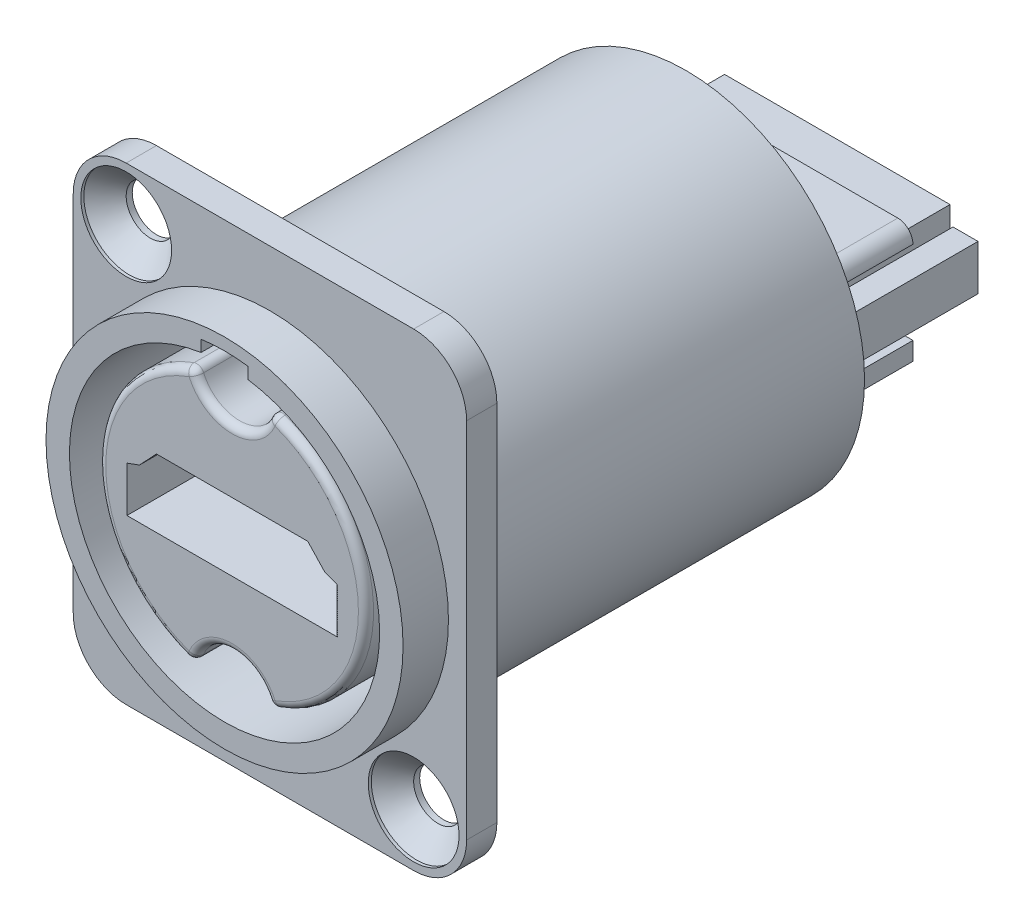
from build123d import *

# Parameters (mm, degrees)
ESQUISSE1_W                                 = 11.8
ESQUISSE1_H                                 = 25.5
ESQUISSE2_W                                 = 24.8
ESQUISSE2_H                                 = 27.3
BOSS_EXTRU_1_DEPTH                          = 2
ESQUISSE3_W                                 = 2
ESQUISSE3_H                                 = 27.3
BOSS_EXTRU_2_DEPTH                          = 1.2
BOSS_EXTRU_3_DEPTH                          = 10
ESQUISSE5_W                                 = 10
ESQUISSE5_H                                 = 1.115484429
ENL_V_MAT_EXTRU_1_DEPTH                     = 3.6
ESQUISSE6_W                                 = 10
ESQUISSE6_H                                 = 1.384515571
ENL_V_MAT_EXTRU_2_DEPTH                     = 1.65
ESQUISSE7_W                                 = 10
ESQUISSE7_H                                 = 1.384515571
ENL_V_MAT_EXTRU_3_DEPTH                     = 1.65
BOSS_EXTRU_4_DEPTH                          = 0.2
BOSS_EXTRU_5_DEPTH                          = 0.2
ESQUISSE10_W                                = 26
ESQUISSE10_H                                = 2
BOSS_EXTRU_6_DEPTH                          = 3.7
BOSS_EXTRU_7_START                          = 3
ESQUISSE11_R                                = 11.8
BOSS_EXTRU_7_DEPTH                          = 3
ENL_V_MAT_EXTRU_4_DEPTH                     = 14
BOSS_EXTRU_8_DEPTH                          = 13.5
ENL_V_MAT_EXTRU_5_DEPTH                     = 11
ESQUISSE15_W                                = 11
ESQUISSE15_H                                = 1
BOSS_EXTRU_9_DEPTH                          = 6.6
ENL_V_MAT_EXTRU_6_DEPTH                     = 12
ESQUISSE17_W                                = 11
ESQUISSE17_H                                = 1
BOSS_EXTRU_10_DEPTH                         = 9.6
D_POUILLE1_ANGLE                            = 20.013261752
D_POUILLE2_ANGLE                            = 20.013261752
D_POUILLE3_ANGLE                            = 20.013261752
D_POUILLE4_ANGLE                            = 20.013261752
D_POUILLE5_ANGLE                            = 43.186676481
D_POUILLE6_ANGLE                            = 43.186676481
D_POUILLE7_ANGLE                            = 43.186676481
FRAISAGE_POUR_VIS_T_TE_FRAIS_E_M31_AT_COUNT = 2
FRAISAGE_POUR_VIS_T_TE_FRAIS_E_M31_AT_PITCH = 30.61045573
NERVURE1_START                              = -8.5
NERVURE1_OUTLINE_W                          = 1
NERVURE1_OUTLINE_H                          = 6.5
NERVURE1_DEPTH                              = 17
NERVURE2_START                              = -8.5
NERVURE2_OUTLINE_W                          = 1.2
NERVURE2_OUTLINE_H                          = 6.5
NERVURE2_DEPTH                              = 17
CHANFREIN1_SIZE                             = 0.027978428
CHANFREIN1_SIZE2                            = 0.021236921
CHANFREIN2_SIZE                             = 0.027978428
CHANFREIN2_SIZE2                            = 0.021236921
CONG_1_R                                    = 0.5
CONG_2_R                                    = 1
CONG_3_R                                    = 3.5


# Read off the part's stored shape, not the designer's step: Nervure1, Nervure2
with BuildPart() as part:
    # Esquisse1 → Révolution1 (revolve)
    with BuildSketch(Plane.XZ, mode=Mode.PRIVATE) as r_volution1_sk:
        with Locations((5.9, -12.75)):
            Rectangle(ESQUISSE1_W, ESQUISSE1_H)
    revolve(r_volution1_sk.sketch.rotate(Axis((0, 0, 0), (0, 0, -1)), 180), axis=Axis((0, 0, 0), (0, 0, -1)))

    # Esquisse2 → Boss.-Extru.1 (add)
    with BuildSketch(Plane(origin=(0, 0, 0), x_dir=(-1, 0, 0), z_dir=(0, 0, -1))):
        with Locations((0.6, -1.85)):
            Rectangle(ESQUISSE2_W, ESQUISSE2_H)
    extrude(amount=-BOSS_EXTRU_1_DEPTH)

    # Esquisse3 → Boss.-Extru.2 (add)
    with BuildSketch(Plane(origin=(11.8, 0, 0), x_dir=(0, 0, -1), z_dir=(1, 0, 0))):
        with Locations((-1, -1.85)):
            Rectangle(ESQUISSE3_W, ESQUISSE3_H)
    extrude(amount=BOSS_EXTRU_2_DEPTH)

    # Esquisse4 → Boss.-Extru.3 (add)
    with BuildSketch(Plane(origin=(0, 0, -25.5), x_dir=(-1, 0, 0), z_dir=(0, 0, -1))):
        Polygon((-9.1, 2.85), (9.1, 2.85), (9.1, -2.65), (-5.5, -2.65), (-5.5, -1.534515571), (-9.1, -1.534515571), align=None)
    extrude(amount=BOSS_EXTRU_3_DEPTH)

    # Esquisse5 → Enlèv. mat.-Extru.1 (cut)
    with BuildSketch(Plane.ZY.offset(9.1)):
        with Locations((-30.5, -2.092257786)):
            Rectangle(ESQUISSE5_W, ESQUISSE5_H)
    extrude(amount=-ENL_V_MAT_EXTRU_1_DEPTH, mode=Mode.SUBTRACT)

    # Esquisse6 → Enlèv. mat.-Extru.2 (cut)
    with BuildSketch(Plane(origin=(9.1, 0, 0), x_dir=(0, 0, -1), z_dir=(1, 0, 0))):
        with Locations((30.5, 2.157742215)):
            Rectangle(ESQUISSE6_W, ESQUISSE6_H)
    extrude(amount=-ENL_V_MAT_EXTRU_2_DEPTH, mode=Mode.SUBTRACT)

    # Esquisse7 → Enlèv. mat.-Extru.3 (cut)
    with BuildSketch(Plane.ZY.offset(9.1)):
        with Locations((-30.5, 2.157742215)):
            Rectangle(ESQUISSE7_W, ESQUISSE7_H)
    extrude(amount=-ENL_V_MAT_EXTRU_3_DEPTH, mode=Mode.SUBTRACT)

    # Esquisse8 → Boss.-Extru.4 (add)
    with BuildSketch(Plane(origin=(0, 0, -35.5), x_dir=(-1, 0, 0), z_dir=(0, 0, -1))):
        Polygon((-6.575, -1.534515571), (-9.1, -1.534515571), (-9.1, 1.465484429), (-7.45, 1.465484429), (-7.45, -1.215812238), align=None)
    extrude(amount=BOSS_EXTRU_4_DEPTH)

    # Esquisse9 → Boss.-Extru.5 (add)
    with BuildSketch(Plane(origin=(0, 0, -35.5), x_dir=(-1, 0, 0), z_dir=(0, 0, -1))):
        Polygon((6.575, -1.534515571), (7.45, -1.215812238), (7.45, 1.465484429), (9.1, 1.465484429), (9.1, -1.534515571), align=None)
    extrude(amount=BOSS_EXTRU_5_DEPTH)

    # Esquisse10 → Boss.-Extru.6 (add)
    with BuildSketch(Plane(origin=(0, 11.8, 0), x_dir=(-1, 0, 0), z_dir=(0, 1, 0))):
        with Locations((0, 1)):
            Rectangle(ESQUISSE10_W, ESQUISSE10_H)
    extrude(amount=BOSS_EXTRU_6_DEPTH)

    # Esquisse11 → Boss.-Extru.7 (add)
    with BuildSketch(Plane.XY.offset(2).offset(BOSS_EXTRU_7_START)):
        with Locations(Location((0, 0, 0), (0, 0, 180))):
            Circle(ESQUISSE11_R)
    extrude(amount=-BOSS_EXTRU_7_DEPTH)

    # Esquisse12 → Enlèv. mat.-Extru.4 (cut)
    with BuildSketch(Plane.XY.offset(5)):
        with BuildLine():
            Line((1.55, 10.132127121), (1.55, 10.890247931))
            ThreePointArc((1.55, 10.890247931), (0, 11), (-1.55, 10.890247931))
            Line((-1.55, 10.890247931), (-1.55, 10.132127121))
            ThreePointArc((-1.55, 10.132127121), (0, -10.25), (1.55, 10.132127121))
        make_face()
    extrude(amount=-ENL_V_MAT_EXTRU_4_DEPTH, mode=Mode.SUBTRACT)

    # Esquisse13 → Boss.-Extru.8 (add)
    with BuildSketch(Plane.XY.offset(-9)):
        with BuildLine():
            ThreePointArc((2.525486644, -8.482005495), (0, -6.5), (-2.525486644, -8.482005495))
            ThreePointArc((-2.525486644, -8.482005495), (-8.85, 0), (-2.525486644, 8.482005495))
            ThreePointArc((-2.525486644, 8.482005495), (0, 6.5), (2.525486644, 8.482005495))
            ThreePointArc((2.525486644, 8.482005495), (8.85, 0), (2.525486644, -8.482005495))
        make_face()
    extrude(amount=BOSS_EXTRU_8_DEPTH)

    # Esquisse14 → Enlèv. mat.-Extru.5 (cut)
    with BuildSketch(Plane.XY.offset(4.5)):
        Polygon((5, 0.85), (5, 2.35), (-5, 2.35), (-5, 0.85), (-6.95, 0.85), (-6.95, -2.15), (6.95, -2.15), (6.95, 0.85), align=None)
    extrude(amount=-ENL_V_MAT_EXTRU_5_DEPTH, mode=Mode.SUBTRACT)

    # Esquisse15 → Boss.-Extru.9 (add)
    with BuildSketch(Plane.XY.offset(-6.5)):
        with Locations((0, 0.05)):
            Rectangle(ESQUISSE15_W, ESQUISSE15_H)
    extrude(amount=BOSS_EXTRU_9_DEPTH)

    # Esquisse16 → Enlèv. mat.-Extru.6 (cut)
    with BuildSketch(Plane(origin=(0, 0, -35.5), x_dir=(-1, 0, 0), z_dir=(0, 0, -1))):
        Polygon((5.283561654, -2.15), (5.283561654, -0.865794698), (6.95, -0.865794698), (6.95, 2.35), (-6.95, 2.35), (-6.95, -0.865794698), (-5.283561654, -0.865794698), (-5.283561654, -2.15), align=None)
    extrude(amount=-ENL_V_MAT_EXTRU_6_DEPTH, mode=Mode.SUBTRACT)

    # Esquisse17 → Boss.-Extru.10 (add)
    with BuildSketch(Plane(origin=(0, 0, -23.5), x_dir=(-1, 0, 0), z_dir=(0, 0, -1))):
        with Locations((0, -0.15)):
            Rectangle(ESQUISSE17_W, ESQUISSE17_H)
    extrude(amount=BOSS_EXTRU_10_DEPTH)

    # Dépouille1
    d_pouille1_faces = [part.faces().sort_by_distance(p)[0] for p in [
        (-6.116780827, -0.865794698, -29.5),
    ]]
    draft(d_pouille1_faces, Plane(origin=(-6.95, -0.865794698, -23.5), x_dir=(0, 1, 0), z_dir=(1, 0, 0)), D_POUILLE1_ANGLE)

    # Dépouille2
    d_pouille2_faces = [part.faces().sort_by_distance(p)[0] for p in [
        (6.116780827, -0.865794698, -29.5),
    ]]
    draft(d_pouille2_faces, Plane(origin=(6.95, 2.35, -23.5), x_dir=(0, -1, 0), z_dir=(-1, 0, 0)), D_POUILLE2_ANGLE)

    # Dépouille3
    d_pouille3_faces = [part.faces().sort_by_distance(p)[0] for p in [
        (-5.975, 0.85, -1),
    ]]
    draft(d_pouille3_faces, Plane(origin=(-6.95, 0.85, -6.5), x_dir=(0, 1, 0), z_dir=(1, 0, 0)), D_POUILLE3_ANGLE)

    # Dépouille4
    d_pouille4_faces = [part.faces().sort_by_distance(p)[0] for p in [
        (5.975, 0.85, -1),
    ]]
    draft(d_pouille4_faces, Plane(origin=(6.95, -2.15, -6.5), x_dir=(0, 0, -1), z_dir=(-1, 0, 0)), D_POUILLE4_ANGLE)

    # Dépouille5
    d_pouille5_faces = [part.faces().sort_by_distance(p)[0] for p in [
        (5.5, -2.092257785, -30.5),
        (-5.5, -2.092257785, -30.5),
    ]]
    draft(d_pouille5_faces, Plane(origin=(-9.1, -2.65, -35.5), x_dir=(-1, 0, 0), z_dir=(0, -1, 0)), D_POUILLE5_ANGLE)

    # Dépouille6
    d_pouille6_faces = [part.faces().sort_by_distance(p)[0] for p in [
        (-5.283561654, -1.811382752, -29.5),
        (5.283561654, -1.811382752, -29.5),
    ]]
    draft(d_pouille6_faces, Plane(origin=(5.283561654, -2.15, -23.5), x_dir=(1, 0, 0), z_dir=(0, 1, 0)), D_POUILLE6_ANGLE)

    # Dépouille7
    d_pouille7_faces = [part.faces().sort_by_distance(p)[0] for p in [
        (-5, 1.955126571, -1),
        (5, 1.955126571, -1),
    ]]
    draft(d_pouille7_faces, Plane(origin=(5, 2.35, -6.5), x_dir=(-1, 0, 0), z_dir=(0, -1, 0)), D_POUILLE7_ANGLE)

    # Esquisse18 → Fraisage pour vis à tête fraisée M31 (revolve, cut)
    with BuildSketch(Plane(origin=(-9.5, 12, 2), x_dir=(0, -1, 0), z_dir=(1, 0, 0))):
        Polygon((0, 0), (0, 37.700025), (1.6, 37.700025), (1.6, 1.599995685), (3, 0.19999191), (3, 0), align=None)
    fraisage_pour_vis_t_te_frais_e_m31 = revolve(axis=Axis((-9.5, 12, 8.35), (0, 0, -1)), mode=Mode.SUBTRACT)

    # Fraisage pour vis à tête fraisée M31 at: Fraisage pour vis à tête fraisée M31 ×2
    with Locations(*[Vector(0.6207029443655612, -0.7840458244617614, 0) * (i * FRAISAGE_POUR_VIS_T_TE_FRAIS_E_M31_AT_PITCH) for i in range(1, FRAISAGE_POUR_VIS_T_TE_FRAIS_E_M31_AT_COUNT)]):
        add(fraisage_pour_vis_t_te_frais_e_m31, mode=Mode.SUBTRACT)

    # Nervure1 outline → Nervure1 (add)
    with BuildSketch(Plane(origin=(0, 0, 0), x_dir=(0, -1, 0), z_dir=(-1, 0, 0)).offset(NERVURE1_START)):
        with Locations((-3.35, -28.75)):
            Rectangle(NERVURE1_OUTLINE_W, NERVURE1_OUTLINE_H)
    extrude(amount=NERVURE1_DEPTH)

    # Nervure2 outline → Nervure2 (add)
    with BuildSketch(Plane(origin=(0, 0, 0), x_dir=(0, -1, 0), z_dir=(-1, 0, 0)).offset(NERVURE2_START)):
        with Locations((3.25, -28.75)):
            Rectangle(NERVURE2_OUTLINE_W, NERVURE2_OUTLINE_H)
    extrude(amount=NERVURE2_DEPTH)

    # Chanfrein1
    chanfrein1_edges = [part.edges().sort_by_distance(p)[0] for p in [
        (6.547021572, -1.534515571, -30.5),
    ]]
    chanfrein1_side = [part.faces().sort_by_distance(p)[0] for p in [
        (7.823782137, -1.534515571, -30.598925344),
    ]]
    chamfer(chanfrein1_edges, length=CHANFREIN1_SIZE, length2=CHANFREIN1_SIZE2, reference=chanfrein1_side[0])

    # Chanfrein2
    chanfrein2_edges = [part.edges().sort_by_distance(p)[0] for p in [
        (-6.547021572, -1.534515571, -30.5),
    ]]
    chanfrein2_side = [part.faces().sort_by_distance(p)[0] for p in [
        (-7.823782137, -1.534515571, -30.598925344),
    ]]
    chamfer(chanfrein2_edges, length=CHANFREIN2_SIZE, length2=CHANFREIN2_SIZE2, reference=chanfrein2_side[0])

    # Congé1
    cong_1_edges = [part.edges().sort_by_distance(p)[0] for p in [
        (2.525486644, -8.482005495, -2.25),
        (2.525486644, 8.482005495, -2.25),
        (-2.525486644, 8.482005495, -2.25),
        (-2.525486644, -8.482005495, -2.25),
        (8.85, 0, 4.5),
        (0, 6.5, 4.5),
        (-8.85, 0, 4.5),
        (0, -6.5, 4.5),
    ]]
    fillet(cong_1_edges, radius=CONG_1_R)

    # Congé2
    cong_2_edges = [part.edges().sort_by_distance(p)[0] for p in [
        (8.5, 3.85, -28.75),
        (-8.5, 3.85, -28.75),
    ]]
    fillet(cong_2_edges, radius=CONG_2_R - 0.0001)  # a hair under: the kernel refuses the full size

    # Congé3
    cong_3_edges = [part.edges().sort_by_distance(p)[0] for p in [
        (-13, -15.5, 1),
        (13, 15.5, 1),
        (-13, 15.5, 1),
        (13, -15.5, 1),
    ]]
    fillet(cong_3_edges, radius=CONG_3_R)


solid = part.part
